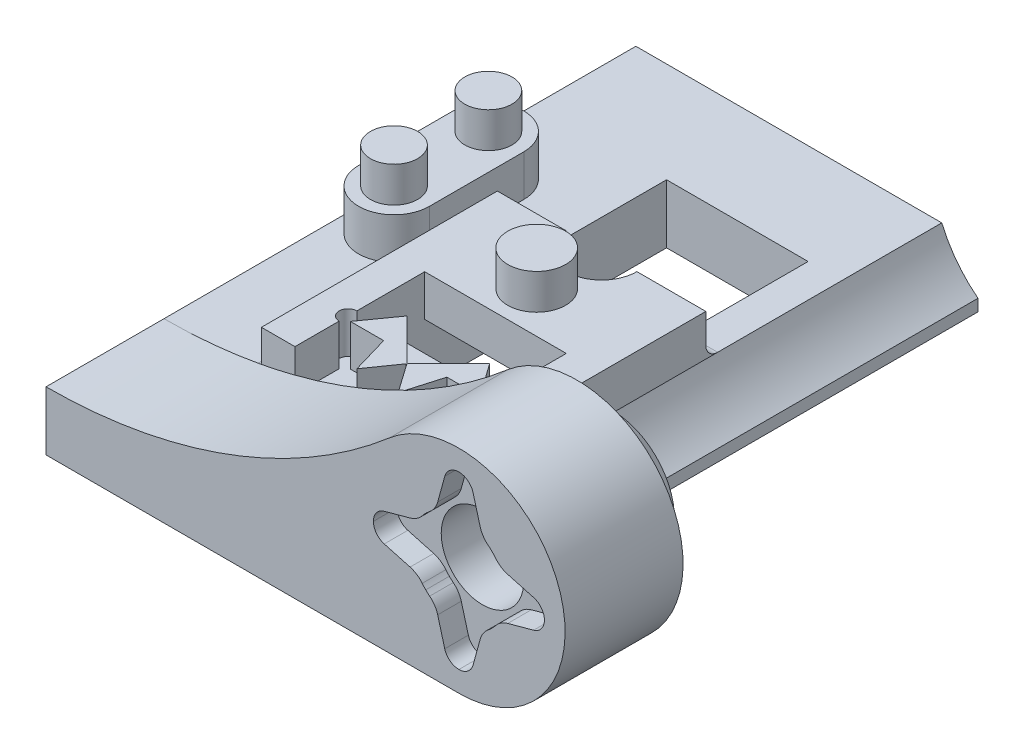
from build123d import *

# Parameters (mm, degrees)
SKETCH2_R           = 9
BOSS_EXTRUDE1_DEPTH = 10
SKETCH3_R           = 7
BOSS_EXTRUDE2_DEPTH = 3
BOSS_EXTRUDE2_TAPER = 30
CUT_EXTRUDE1_DEPTH  = 2
BOSS_EXTRUDE3_DEPTH = 40
SKETCH6_W           = 12
SKETCH6_H           = 23
CUT_EXTRUDE3_DEPTH  = 55.717456081
BOSS_EXTRUDE4_DEPTH = 3.5
SKETCH8_R           = 2
BOSS_EXTRUDE5_DEPTH = 3
SKETCH9_R           = 3.5
CUT_EXTRUDE4_DEPTH  = 52.720402164
BOSS_EXTRUDE6_DEPTH = 3.5
SKETCH11_R          = 2.45
BOSS_EXTRUDE7_DEPTH = 3
BOSS_EXTRUDE9_DEPTH = 3.5
FILLET1_START       = -26.74
FILLET1_DEPTH       = 2.84
FILLET1_START_2     = -11.9
FILLET1_2_DEPTH     = 2.83
FILLET1_START_3     = -21
FILLET1_3_DEPTH     = 21
FILLET1_START_4     = -27.74
FILLET1_4_DEPTH     = 1


with BuildPart() as part:
    # Sketch2 → Boss-Extrude1 (new body)
    with BuildSketch(Plane.XY):
        with BuildLine():
            Line((-35, -9), (0, -9))
            ThreePointArc((0, -9), (-8.437416666, -3.132091953), (-5.872614409, 6.82))
            ThreePointArc((-5.872614409, 6.82), (-19.465199243, -1.204217751), (-35, -4))
            Line((-35, -4), (-35, -9))
        make_face()
        Circle(SKETCH2_R)
    extrude(amount=BOSS_EXTRUDE1_DEPTH)

    # Sketch3 → Boss-Extrude2 (add)
    with BuildSketch(Plane(origin=(0, 0, 0), x_dir=(-1, 0, 0), z_dir=(0, 0, -1))):
        Circle(SKETCH3_R)
    extrude(amount=BOSS_EXTRUDE2_DEPTH, taper=BOSS_EXTRUDE2_TAPER)

    # Sketch4 → Cut-Extrude1 (cut)
    with BuildSketch(Plane.XY.offset(10)):
        with BuildLine():
            Line((1.2, -6.33), (1.8, -4.1378116))
            ThreePointArc((1.8, -4.1378116), (2.058560194, -3.569045514), (2.48, -3.1078116))
            ThreePointArc((2.48, -3.1078116), (2.64989874, -2.964295475), (2.811558399, -2.811558399))
            ThreePointArc((2.811558399, -2.811558399), (2.964295475, -2.64989874), (3.1078116, -2.48))
            ThreePointArc((3.1078116, -2.48), (3.569045514, -2.058560194), (4.1378116, -1.8))
            Line((4.1378116, -1.8), (6.33, -1.2))
            ThreePointArc((6.33, -1.2), (6.992020752, -0.754882576), (7.25, 0))
            ThreePointArc((7.25, 0), (6.992020752, 0.754882576), (6.33, 1.2))
            Line((6.33, 1.2), (4.1378116, 1.8))
            ThreePointArc((4.1378116, 1.8), (3.569045514, 2.058560194), (3.1078116, 2.48))
            ThreePointArc((3.1078116, 2.48), (2.964295475, 2.64989874), (2.811558399, 2.811558399))
            ThreePointArc((2.811558399, 2.811558399), (2.64989874, 2.964295475), (2.48, 3.1078116))
            ThreePointArc((2.48, 3.1078116), (2.058560194, 3.569045514), (1.8, 4.1378116))
            Line((1.8, 4.1378116), (1.2, 6.33))
            ThreePointArc((1.2, 6.33), (0.754882576, 6.992020752), (0, 7.25))
            ThreePointArc((0, 7.25), (-0.754882576, 6.992020752), (-1.2, 6.33))
            Line((-1.2, 6.33), (-1.8, 4.1378116))
            ThreePointArc((-1.8, 4.1378116), (-2.058560194, 3.569045514), (-2.48, 3.1078116))
            ThreePointArc((-2.48, 3.1078116), (-2.64989874, 2.964295475), (-2.811558399, 2.811558399))
            ThreePointArc((-2.811558399, 2.811558399), (-2.964295475, 2.64989874), (-3.1078116, 2.48))
            ThreePointArc((-3.1078116, 2.48), (-3.569045514, 2.058560194), (-4.1378116, 1.8))
            Line((-4.1378116, 1.8), (-6.33, 1.2))
            ThreePointArc((-6.33, 1.2), (-6.992020752, 0.754882576), (-7.25, 0))
            ThreePointArc((-7.25, 0), (-6.992020752, -0.754882576), (-6.33, -1.2))
            Line((-6.33, -1.2), (-4.1378116, -1.8))
            ThreePointArc((-4.1378116, -1.8), (-3.569045514, -2.058560194), (-3.1078116, -2.48))
            ThreePointArc((-3.1078116, -2.48), (-2.964295475, -2.64989874), (-2.811558399, -2.811558399))
            ThreePointArc((-2.811558399, -2.811558399), (-2.64989874, -2.964295475), (-2.48, -3.1078116))
            ThreePointArc((-2.48, -3.1078116), (-2.058560194, -3.569045514), (-1.8, -4.1378116))
            Line((-1.8, -4.1378116), (-1.2, -6.33))
            ThreePointArc((-1.2, -6.33), (-0.754882576, -6.992020752), (0, -7.25))
            ThreePointArc((0, -7.25), (0.754882576, -6.992020752), (1.2, -6.33))
        make_face()
    extrude(amount=-CUT_EXTRUDE1_DEPTH, mode=Mode.SUBTRACT)

    # Sketch5 → Boss-Extrude3 (add)
    with BuildSketch(Plane(origin=(0, 0, 0), x_dir=(-1, 0, 0), z_dir=(0, 0, -1))):
        with BuildLine():
            Line((35, -9), (35, -4))
            Line((35, -4), (9.07, -4))
            ThreePointArc((9.07, -4), (7.791254425, -6.196675271), (6, -8))
            Line((6, -8), (6, -9))
            Line((6, -9), (35, -9))
        make_face()
    extrude(amount=BOSS_EXTRUDE3_DEPTH)

    # Sketch6 → Cut-Extrude3 (cut, through all)
    with BuildSketch(Plane(origin=(0, -4, 0), x_dir=(1, 0, 0), z_dir=(0, 1, 0))):
        with Locations((-17.9, 20)):
            Rectangle(SKETCH6_W, SKETCH6_H)
    extrude(amount=-CUT_EXTRUDE3_DEPTH, mode=Mode.SUBTRACT)

    # Sketch7 → Boss-Extrude4 (add)
    with BuildSketch(Plane(origin=(0, -4, 0), x_dir=(1, 0, 0), z_dir=(0, 1, 0))):
        with BuildLine():
            Line((-34.5, 16), (-34.5, 24))
            ThreePointArc((-34.5, 24), (-31.5, 27), (-28.5, 24))
            Line((-28.5, 24), (-28.5, 16))
            ThreePointArc((-28.5, 16), (-31.5, 13), (-34.5, 16))
        make_face()
    extrude(amount=BOSS_EXTRUDE4_DEPTH)

    # Sketch8 → Boss-Extrude5 (add)
    with BuildSketch(Plane(origin=(0, -0.5, 0), x_dir=(1, 0, 0), z_dir=(0, 1, 0))):
        with Locations(Location((-31.5, 24, 0), (0, 0, 180))):
            Circle(SKETCH8_R)
        with Locations((-31.5, 16)):
            Circle(SKETCH8_R)
    extrude(amount=BOSS_EXTRUDE5_DEPTH)

    # Sketch9 → Cut-Extrude4 (cut, through all)
    with BuildSketch(Plane(origin=(0, 0, -3), x_dir=(-1, 0, 0), z_dir=(0, 0, -1))):
        Circle(SKETCH9_R)
    extrude(amount=-CUT_EXTRUDE4_DEPTH, mode=Mode.SUBTRACT)

    # Sketch10 → Boss-Extrude6 (add)
    with BuildSketch(Plane(origin=(0, -4, 0), x_dir=(1, 0, 0), z_dir=(0, 1, 0))):
        with BuildLine():
            Line((-26.74, 0), (-26.74, 20))
            Line((-26.74, 20), (-20.91, 20))
            ThreePointArc((-20.91, 20), (-17.91, 17), (-14.91, 20))
            Line((-14.91, 20), (-9.07, 20))
            Line((-9.07, 20), (-9.07, 0))
            Line((-9.07, 0), (-11.9, 0))
            Line((-11.9, 0), (-11.9, 3.75))
            ThreePointArc((-11.9, 3.75), (-11.15, 4.5), (-11.9, 5.25))
            Line((-11.9, 5.25), (-11.9, 11))
            Line((-11.9, 11), (-23.9, 11))
            Line((-23.9, 11), (-23.9, 5.25))
            ThreePointArc((-23.9, 5.25), (-24.65, 4.5), (-23.9, 3.75))
            Line((-23.9, 3.75), (-23.9, 0))
            Line((-23.9, 0), (-26.74, 0))
        make_face()
    extrude(amount=BOSS_EXTRUDE6_DEPTH)

    # Sketch11 → Boss-Extrude7 (add)
    with BuildSketch(Plane(origin=(0, -0.5, 0), x_dir=(1, 0, 0), z_dir=(0, 1, 0))):
        with Locations(Location((-17.905833333, 14.5, 0), (0, 0, 180))):
            Circle(SKETCH11_R)
    extrude(amount=BOSS_EXTRUDE7_DEPTH)

    # Sketch12 → Boss-Extrude9 (add)
    with BuildSketch(Plane(origin=(0, -4, 0), x_dir=(1, 0, 0), z_dir=(0, 1, 0))):
        Polygon((-20.58, 4.2), (-19.65, 1), (-17.93, 3.45), (-17.87, 3.45), (-16.15, 1), (-15.22, 4.2), (-12.4, 4.2), (-14.4, 7), (-17.85, 3.55), (-17.95, 3.55), (-21.4, 7), (-23.4, 4.2), align=None)
    extrude(amount=BOSS_EXTRUDE9_DEPTH)

    # Fillet1: read off the stored shape, not the designer's step
    # Fillet1 outline → Fillet1 (add)
    with BuildSketch(Plane.YZ.offset(FILLET1_START)):
        with BuildLine():
            ThreePointArc((-4, -21), (-3.707106781, -20.292893219), (-3, -20))
            Line((-3, -20), (-4, -20))
            Line((-4, -20), (-4, -21))
        make_face()
    extrude(amount=FILLET1_DEPTH)

    # Fillet1 2 outline → Fillet1 2 (add)
    with BuildSketch(Plane.YZ.offset(FILLET1_START_2)):
        with BuildLine():
            ThreePointArc((-4, -21), (-3.707106781, -20.292893219), (-3, -20))
            Line((-3, -20), (-4, -20))
            Line((-4, -20), (-4, -21))
        make_face()
    extrude(amount=FILLET1_2_DEPTH)

    # Fillet1 3 outline → Fillet1 3 (add)
    with BuildSketch(Plane.XY.offset(FILLET1_START_3)):
        with BuildLine():
            Line((-26.74, -4), (-26.74, -3))
            ThreePointArc((-26.74, -3), (-27.032893219, -3.707106781), (-27.74, -4))
            Line((-27.74, -4), (-26.74, -4))
        make_face()
    extrude(amount=FILLET1_3_DEPTH)

    # Fillet1 4 outline → Fillet1 4 (cut)
    with BuildSketch(Plane.YZ.offset(FILLET1_START_4)):
        with BuildLine():
            Line((-2, -19.999999999), (-3, -20))
            ThreePointArc((-3, -20), (-3.707106781, -20.292893219), (-4, -21))
            Line((-4, -21), (-2, -21))
            Line((-2, -21), (-2, -19.999999999))
        make_face()
    extrude(amount=FILLET1_4_DEPTH, mode=Mode.SUBTRACT)


solid = part.part
